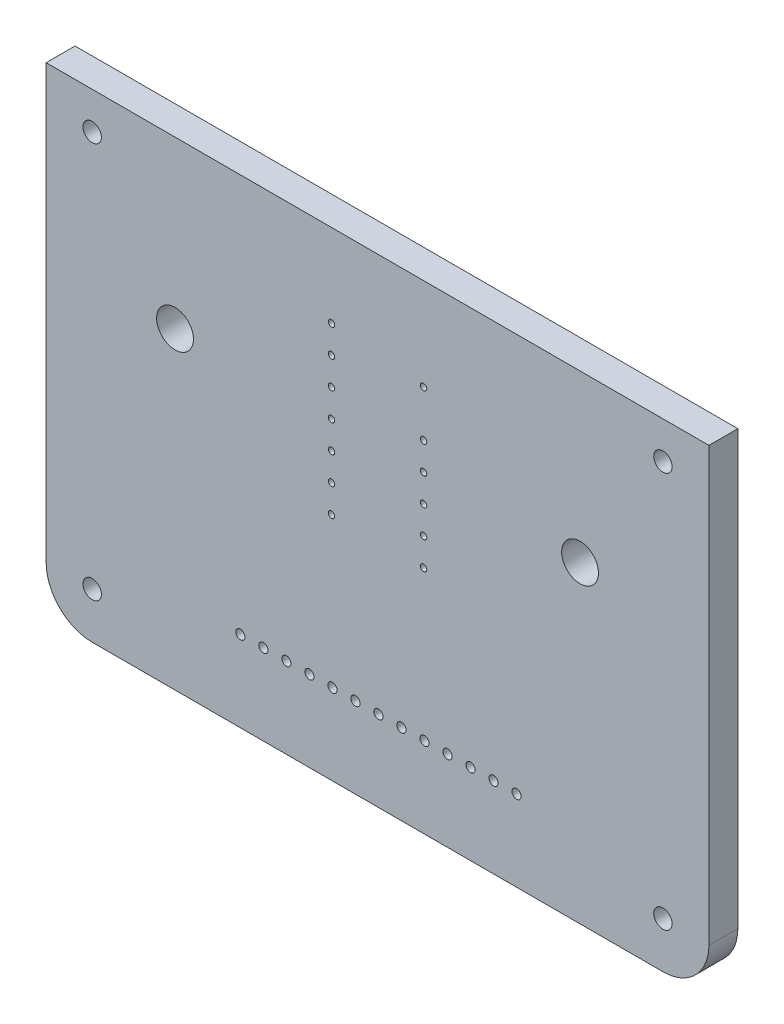
from build123d import *

# Parameters (mm, degrees)
ESQUISSE1_W             = 36
ESQUISSE1_H             = 26.01
ESQUISSE1_R             = 0.175
ESQUISSE1_R_2           = 0.5
ESQUISSE1_R_3           = 0.25
BOSS_EXTRU_1_DEPTH      = 1.57
ENL_V_MAT_EXTRU_1_REACH = 46.441
ESQUISSE2_R             = 1
CONG_1_R                = 2.5


with BuildPart() as part:
    # Esquisse1 → Boss.-Extru.1 (new body)
    with BuildSketch(Plane(origin=(0, 0, 0), x_dir=(-1, 0, 0), z_dir=(0, 0, -1))):
        with Locations((-18, 13.005)):
            Rectangle(ESQUISSE1_W, ESQUISSE1_H)
        with Locations((-15.5, 21.5)):
            Circle(ESQUISSE1_R, mode=Mode.SUBTRACT)
        with Locations((-15.5, 20)):
            Circle(ESQUISSE1_R, mode=Mode.SUBTRACT)
        with Locations((-15.5, 18.5)):
            Circle(ESQUISSE1_R, mode=Mode.SUBTRACT)
        with Locations((-15.5, 15.5)):
            Circle(ESQUISSE1_R, mode=Mode.SUBTRACT)
        with Locations((-15.5, 17)):
            Circle(ESQUISSE1_R, mode=Mode.SUBTRACT)
        with Locations((-15.5, 12.5)):
            Circle(ESQUISSE1_R, mode=Mode.SUBTRACT)
        with Locations((-15.5, 14)):
            Circle(ESQUISSE1_R, mode=Mode.SUBTRACT)
        with Locations((-7, 17)):
            Circle(ESQUISSE1_R_2, mode=Mode.SUBTRACT)
        with Locations((-20.5, 21)):
            Circle(ESQUISSE1_R, mode=Mode.SUBTRACT)
        with Locations((-20.5, 18.5)):
            Circle(ESQUISSE1_R, mode=Mode.SUBTRACT)
        with Locations((-20.5, 15.5)):
            Circle(ESQUISSE1_R, mode=Mode.SUBTRACT)
        with Locations((-20.5, 17)):
            Circle(ESQUISSE1_R, mode=Mode.SUBTRACT)
        with Locations((-20.5, 12.5)):
            Circle(ESQUISSE1_R, mode=Mode.SUBTRACT)
        with Locations((-20.5, 14)):
            Circle(ESQUISSE1_R, mode=Mode.SUBTRACT)
        with Locations((-2.5, 24)):
            Circle(ESQUISSE1_R_2, mode=Mode.SUBTRACT)
        with Locations((-29, 17)):
            Circle(ESQUISSE1_R_2, mode=Mode.SUBTRACT)
        with Locations((-2.5, 2.5)):
            Circle(ESQUISSE1_R_2, mode=Mode.SUBTRACT)
        with Locations((-33.5, 2.5)):
            Circle(ESQUISSE1_R_2, mode=Mode.SUBTRACT)
        with Locations((-33.5, 24)):
            Circle(ESQUISSE1_R_2, mode=Mode.SUBTRACT)
        with Locations((-10.55, 4.39)):
            Circle(ESQUISSE1_R_3, mode=Mode.SUBTRACT)
        with Locations((-13.05, 4.39)):
            Circle(ESQUISSE1_R_3, mode=Mode.SUBTRACT)
        with Locations((-15.55, 4.39)):
            Circle(ESQUISSE1_R_3, mode=Mode.SUBTRACT)
        with Locations((-25.55, 4.39)):
            Circle(ESQUISSE1_R_3, mode=Mode.SUBTRACT)
        with Locations((-19.3, 4.39)):
            Circle(ESQUISSE1_R_3, mode=Mode.SUBTRACT)
        with Locations((-21.8, 4.39)):
            Circle(ESQUISSE1_R_3, mode=Mode.SUBTRACT)
        with Locations((-24.3, 4.39)):
            Circle(ESQUISSE1_R_3, mode=Mode.SUBTRACT)
        with Locations((-23.05, 4.39)):
            Circle(ESQUISSE1_R_3, mode=Mode.SUBTRACT)
        with Locations((-20.55, 4.39)):
            Circle(ESQUISSE1_R_3, mode=Mode.SUBTRACT)
        with Locations((-18.05, 4.39)):
            Circle(ESQUISSE1_R_3, mode=Mode.SUBTRACT)
        with Locations((-16.8, 4.39)):
            Circle(ESQUISSE1_R_3, mode=Mode.SUBTRACT)
        with Locations((-14.3, 4.39)):
            Circle(ESQUISSE1_R_3, mode=Mode.SUBTRACT)
        with Locations((-11.8, 4.39)):
            Circle(ESQUISSE1_R_3, mode=Mode.SUBTRACT)
    extrude(amount=-BOSS_EXTRU_1_DEPTH)

    # Esquisse2 → Enlèv. mat.-Extru.1 (cut, up to next)
    with BuildSketch(Plane.XY.offset(1.57), mode=Mode.PRIVATE) as enl_v_mat_extru_1_sk1:
        with Locations((7, 17)):
            Circle(ESQUISSE2_R)
    enl_v_mat_extru_1_tool1 = extrude(enl_v_mat_extru_1_sk1.sketch, amount=-ENL_V_MAT_EXTRU_1_REACH, mode=Mode.PRIVATE) & part.part
    # Esquisse2 → Enlèv. mat.-Extru.1 (cut, up to next)
    with BuildSketch(Plane.XY.offset(1.57), mode=Mode.PRIVATE) as enl_v_mat_extru_1_sk2:
        with Locations((29, 17)):
            Circle(ESQUISSE2_R)
    enl_v_mat_extru_1_tool2 = extrude(enl_v_mat_extru_1_sk2.sketch, amount=-ENL_V_MAT_EXTRU_1_REACH, mode=Mode.PRIVATE) & part.part
    add(enl_v_mat_extru_1_tool1.solids().sort_by_distance((7, 17, 1.57))[0], mode=Mode.SUBTRACT)
    add(enl_v_mat_extru_1_tool2.solids().sort_by_distance((29, 17, 1.57))[0], mode=Mode.SUBTRACT)

    # Congé1
    cong_1_edges = [part.edges().sort_by_distance(p)[0] for p in [
        (36, 0, 0.785),
        (0, 0, 0.785),
    ]]
    fillet(cong_1_edges, radius=CONG_1_R)


solid = part.part
